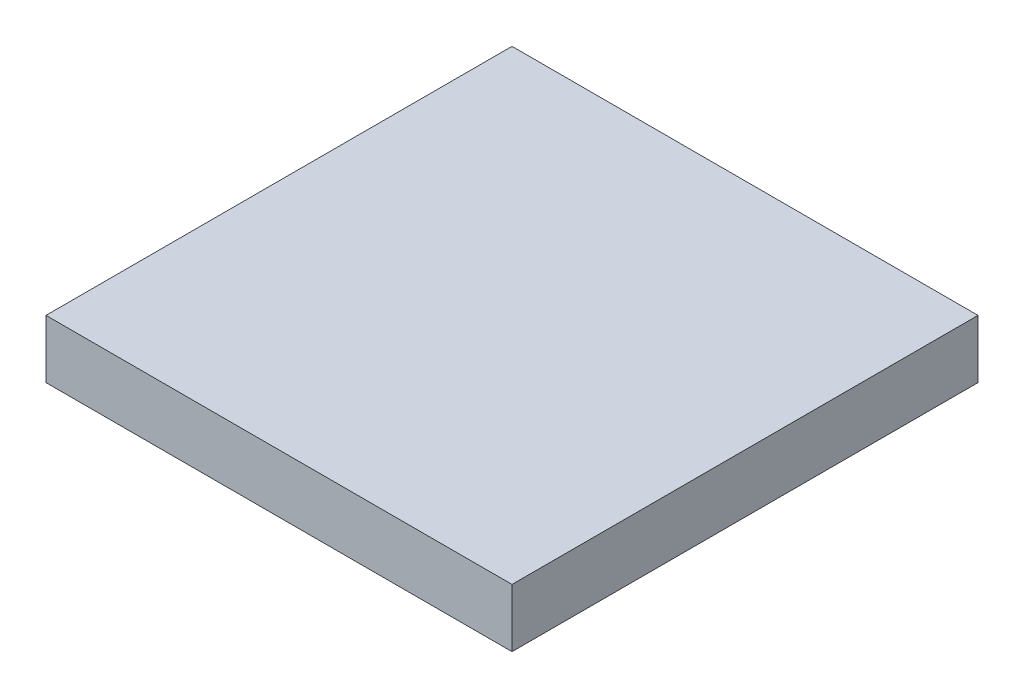
from build123d import *

# Parameters (mm, degrees)
ESQUISSE1_W        = 240
ESQUISSE1_H        = 240
BOSS_EXTRU_1_DEPTH = 30


with BuildPart() as part:
    # Esquisse1 → Boss.-Extru.1 (new body)
    with BuildSketch(Plane(origin=(0, 0, 0), x_dir=(1, 0, 0), z_dir=(0, 1, 0))):
        Rectangle(ESQUISSE1_W, ESQUISSE1_H)
    extrude(amount=BOSS_EXTRU_1_DEPTH)


solid = part.part
